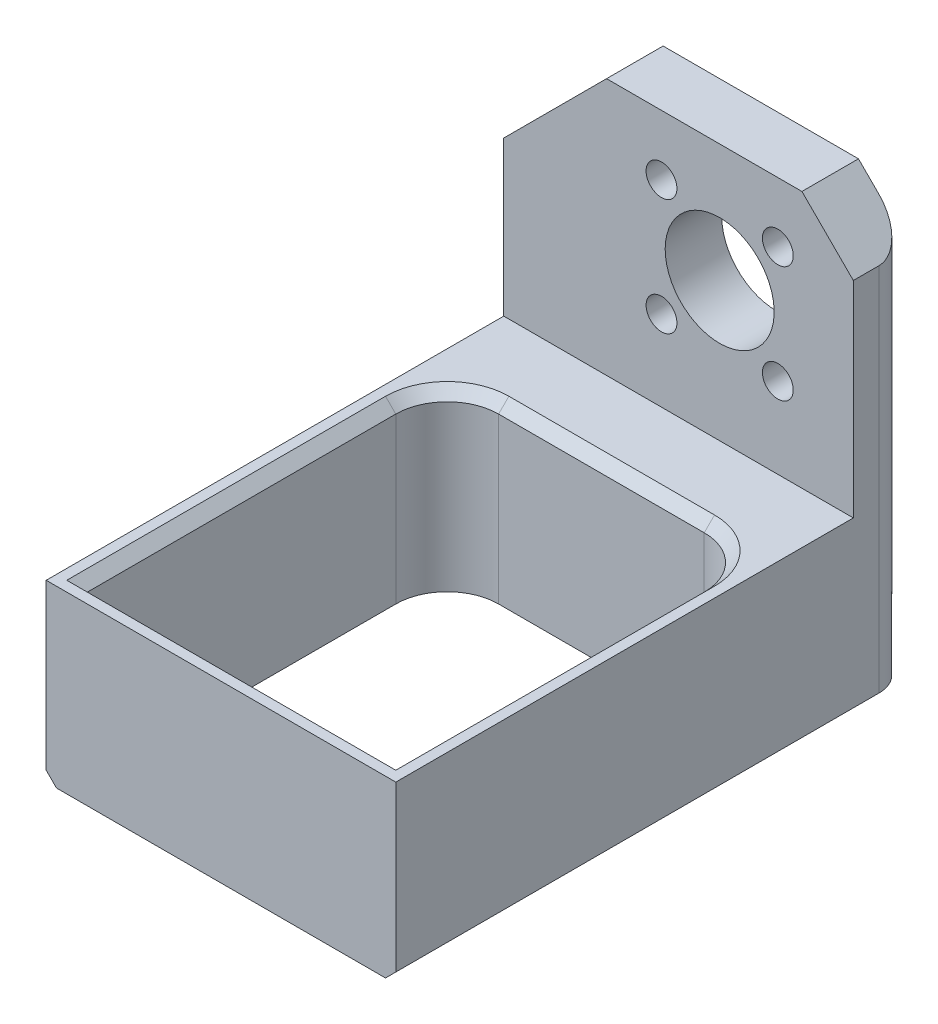
from build123d import *

# Parameters (mm, degrees)
SZKIC1_W                    = 34
SZKIC1_H                    = 50
DODANIE_WYCI_GNI_CIE1_DEPTH = 17
SZKIC2_W                    = 30
SZKIC2_H                    = 30
WYTNIJ_WYCI_GNI_CIE1_DEPTH  = 20
SZKIC3_W                    = 34
SZKIC3_H                    = 5.5
DODANIE_WYCI_GNI_CIE2_DEPTH = 25
SZKIC4_R                    = 1.5
SZKIC4_R_2                  = 5.3
WYTNIJ_WYCI_GNI_CIE2_DEPTH  = 25
SFAZOWANIE1_SIZE            = 10
SFAZOWANIE2_SIZE            = 5
ZAOKR_GLENIE1_R             = 3
SZKIC5_W                    = 30
SZKIC5_H                    = 17
WYTNIJ_WYCI_GNI_CIE3_DEPTH  = 5
ZAOKR_GLENIE2_R             = 5
SFAZOWANIE3_SIZE            = 1
SFAZOWANIE4_SIZE            = 1


with BuildPart() as part:
    # Szkic1 → Dodanie-wyciągnięcie1 (new body)
    with BuildSketch(Plane(origin=(0, 0, 0), x_dir=(1, 0, 0), z_dir=(0, 1, 0))):
        Rectangle(SZKIC1_W, SZKIC1_H)
    extrude(amount=DODANIE_WYCI_GNI_CIE1_DEPTH)

    # Szkic2 → Wytnij-wyciągnięcie1 (cut)
    with BuildSketch(Plane(origin=(0, 17, 0), x_dir=(1, 0, 0), z_dir=(0, 1, 0))):
        with Locations((0, -8)):
            Rectangle(SZKIC2_W, SZKIC2_H)
    extrude(amount=-WYTNIJ_WYCI_GNI_CIE1_DEPTH, mode=Mode.SUBTRACT)

    # Szkic3 → Dodanie-wyciągnięcie2 (add)
    with BuildSketch(Plane(origin=(0, 17, 0), x_dir=(1, 0, 0), z_dir=(0, 1, 0))):
        with Locations((0, 22.25)):
            Rectangle(SZKIC3_W, SZKIC3_H)
    extrude(amount=DODANIE_WYCI_GNI_CIE2_DEPTH)

    # Szkic4 → Wytnij-wyciągnięcie2 (cut)
    with BuildSketch(Plane(origin=(0, 0, -25), x_dir=(-1, 0, 0), z_dir=(0, 0, -1))):
        with Locations((1.656854249, 36.156854249)):
            Circle(SZKIC4_R)
        with Locations((-9.656854249, 36.156854249)):
            Circle(SZKIC4_R)
        with Locations((1.656854249, 24.843145751)):
            Circle(SZKIC4_R)
        with Locations((-9.656854249, 24.843145751)):
            Circle(SZKIC4_R)
        with Locations((-4, 30.5)):
            Circle(SZKIC4_R_2)
    extrude(amount=-WYTNIJ_WYCI_GNI_CIE2_DEPTH, mode=Mode.SUBTRACT)

    # Sfazowanie1
    sfazowanie1_edges = [part.edges().sort_by_distance(p)[0] for p in [
        (-17, 42, -22.25),
    ]]
    chamfer(sfazowanie1_edges, length=SFAZOWANIE1_SIZE)

    # Sfazowanie2
    sfazowanie2_edges = [part.edges().sort_by_distance(p)[0] for p in [
        (17, 42, -22.25),
    ]]
    chamfer(sfazowanie2_edges, length=SFAZOWANIE2_SIZE)

    # Zaokrąglenie1
    zaokr_glenie1_edges = [part.edges().sort_by_distance(p)[0] for p in [
        (17, 18.5, -25),
        (-17, 16, -25),
    ]]
    fillet(zaokr_glenie1_edges, radius=ZAOKR_GLENIE1_R)

    # Szkic5 → Wytnij-wyciągnięcie3 (cut)
    with BuildSketch(Plane.XY.offset(-7)):
        with Locations((0, 8.5)):
            Rectangle(SZKIC5_W, SZKIC5_H)
    extrude(amount=-WYTNIJ_WYCI_GNI_CIE3_DEPTH, mode=Mode.SUBTRACT)

    # Zaokrąglenie2
    zaokr_glenie2_edges = [part.edges().sort_by_distance(p)[0] for p in [
        (15, 8.5, -12),
        (-15, 8.5, -12),
    ]]
    fillet(zaokr_glenie2_edges, radius=ZAOKR_GLENIE2_R)

    # Sfazowanie3
    sfazowanie3_edges = [part.edges().sort_by_distance(p)[0] for p in [
        (13.535533906, 17, -10.535533906),
        (-13.535533906, 17, -10.535533906),
        (15, 17, 8),
        (0, 17, 23),
        (-15, 17, 8),
        (0, 17, -12),
    ]]
    chamfer(sfazowanie3_edges, length=SFAZOWANIE3_SIZE)

    # Sfazowanie4
    sfazowanie4_edges = [part.edges().sort_by_distance(p)[0] for p in [
        (17, 0, 1.5),
        (-17, 0, 1.5),
        (16.121320344, 0, -24.121320344),
        (-16.121320344, 0, -24.121320344),
        (0, 0, -25),
    ]]
    chamfer(sfazowanie4_edges, length=SFAZOWANIE4_SIZE)


solid = part.part
